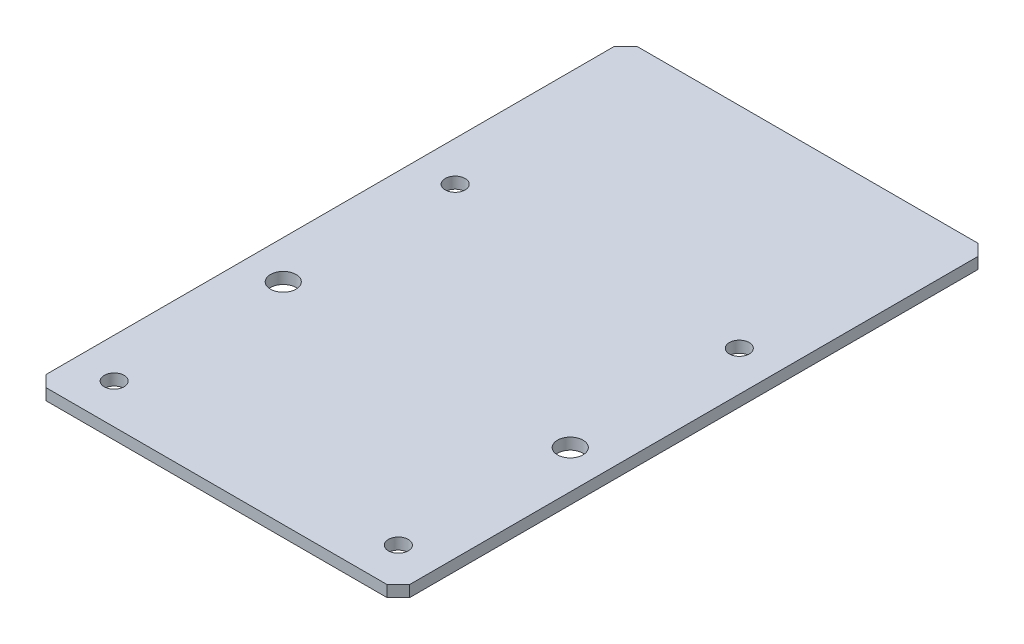
from build123d import *

# Parameters (mm, degrees)
SKETCH1_W          = 64
SKETCH1_H          = 2
BASE_FLANGE1_DEPTH = 74
SKETCH2_R          = 1.75
CUT_EXTRUDE1_DEPTH = 10
CHAMFER1_SIZE      = 2
SKETCH8_W          = 64
SKETCH8_H          = 30
TAB1_DEPTH         = 2
CHAMFER2_SIZE      = 2
CUT_EXTRUDE2_REACH = 82.647
SKETCH9_R          = 2.25


# Sheet-metal steps are written as plain solids
with BuildPart() as part:
    # Sketch1 → Base-Flange1 (new body)
    with BuildSketch(Plane.XY):
        with Locations((0, -1)):
            Rectangle(SKETCH1_W, SKETCH1_H)
    extrude(amount=BASE_FLANGE1_DEPTH)

    # Sketch2 → Cut-Extrude1 (cut)
    with BuildSketch(Plane(origin=(0, 0, 0), x_dir=(1, 0, 0), z_dir=(0, 1, 0))):
        with Locations(Location((-25, -7, 0), (0, 0, 270))):
            Circle(SKETCH2_R)
        with Locations(Location((-25, -67, 0), (0, 0, 270))):
            Circle(SKETCH2_R)
        with Locations(Location((25, -67, 0), (0, 0, 270))):
            Circle(SKETCH2_R)
        with Locations(Location((25, -7, 0), (0, 0, 270))):
            Circle(SKETCH2_R)
    extrude(amount=-CUT_EXTRUDE1_DEPTH, mode=Mode.SUBTRACT)

    # Chamfer1
    chamfer1_edges = [part.edges().sort_by_distance(p)[0] for p in [
        (-32, -1, 74),
        (32, -1, 74),
    ]]
    chamfer(chamfer1_edges, length=CHAMFER1_SIZE)

    # Sketch8 → Tab1 (add)
    with BuildSketch(Plane(origin=(0, 0, 0), x_dir=(1, 0, 0), z_dir=(0, 1, 0))):
        with Locations((0, 15)):
            Rectangle(SKETCH8_W, SKETCH8_H)
    extrude(amount=-TAB1_DEPTH)

    # Chamfer2
    chamfer2_edges = [part.edges().sort_by_distance(p)[0] for p in [
        (-32, -1, -30),
        (32, -1, -30),
    ]]
    chamfer(chamfer2_edges, length=CHAMFER2_SIZE)

    # Sketch9 → Cut-Extrude2 (cut, up to next)
    with BuildSketch(Plane(origin=(0, 0, 0), x_dir=(1, 0, 0), z_dir=(0, 1, 0)), mode=Mode.PRIVATE) as cut_extrude2_sk1:
        with Locations(Location((-25.25, -37, 0), (0, 0, 270))):
            Circle(SKETCH9_R)
    cut_extrude2_tool1 = extrude(cut_extrude2_sk1.sketch, amount=-CUT_EXTRUDE2_REACH, mode=Mode.PRIVATE) & part.part
    # Sketch9 → Cut-Extrude2 (cut, up to next)
    with BuildSketch(Plane(origin=(0, 0, 0), x_dir=(1, 0, 0), z_dir=(0, 1, 0)), mode=Mode.PRIVATE) as cut_extrude2_sk2:
        with Locations(Location((25.25, -37, 0), (0, 0, 270))):
            Circle(SKETCH9_R)
    cut_extrude2_tool2 = extrude(cut_extrude2_sk2.sketch, amount=-CUT_EXTRUDE2_REACH, mode=Mode.PRIVATE) & part.part
    add(cut_extrude2_tool1.solids().sort_by_distance((-25.25, 0, 37))[0], mode=Mode.SUBTRACT)
    add(cut_extrude2_tool2.solids().sort_by_distance((25.25, 0, 37))[0], mode=Mode.SUBTRACT)


solid = part.part
